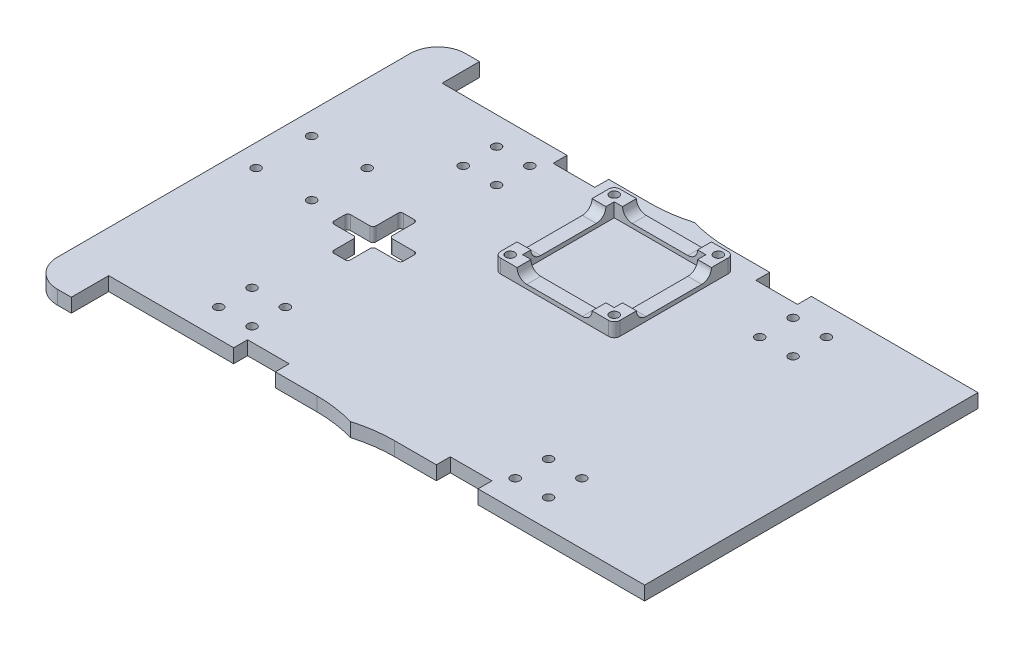
from build123d import *

# Parameters (mm, degrees)
SKETCH1_W            = 208
SKETCH1_H            = 147
BOSS_EXTRUDE1_DEPTH  = 5
CUT_EXTRUDE2_DEPTH   = 128.449009412
MIRROR2_COPY_1_DEPTH = 128.449009412
FILLET1_R            = 10
CUT_EXTRUDE3_DEPTH   = 128.449009412
SKETCH5_R            = 1.6
CUT_EXTRUDE4_DEPTH   = 10
SKETCH8_R            = 1.6
CUT_EXTRUDE5_DEPTH   = 10
SKETCH9_W            = 43
SKETCH9_H            = 43
SKETCH9_W_2          = 33
SKETCH9_H_2          = 33
BOSS_EXTRUDE3_DEPTH  = 5
SKETCH10_W           = 27
SKETCH10_H           = 3.5
CUT_EXTRUDE6_DEPTH   = 62
SKETCH11_W           = 27
SKETCH11_H           = 3.5
CUT_EXTRUDE7_DEPTH   = 62
FILLET4_R            = 3.5
SKETCH12_R           = 1.6
CUT_EXTRUDE8_DEPTH   = 62
FILLET5_R            = 3.5
FILLET6_R            = 2
SKETCH14_W           = 15
SKETCH14_H           = 13.472377551
CUT_EXTRUDE10_DEPTH  = 10


with BuildPart() as part:
    # Sketch1 → Boss-Extrude1 (new body)
    with BuildSketch(Plane(origin=(0, 0, 0), x_dir=(1, 0, 0), z_dir=(0, 1, 0))):
        Rectangle(SKETCH1_W, SKETCH1_H)
    extrude(amount=BOSS_EXTRUDE1_DEPTH)

    # Sketch2 → Cut-Extrude2 (cut, through all)
    with BuildSketch(Plane(origin=(0, 5, 0), x_dir=(1, 0, 0), z_dir=(0, 1, 0))):
        with BuildLine():
            Line((-89, 80.027622449), (-89, 60.027622449))
            Line((-89, 60.027622449), (-44, 60.027622449))
            Line((-44, 60.027622449), (-44, 55.027622449))
            Line((-44, 55.027622449), (-29, 55.027622449))
            Line((-29, 55.027622449), (-29, 60.027622449))
            Line((-29, 60.027622449), (-14, 60.027622449))
            ThreePointArc((-14, 60.027622449), (-6.928932188, 60.530147766), (0, 62.027622449))
            Line((0, 62.027622449), (0, 82.027622449))
            Line((0, 82.027622449), (-89, 82.027622449))
            Line((-89, 82.027622449), (-89, 80.027622449))
        make_face()
    cut_extrude2 = extrude(amount=-CUT_EXTRUDE2_DEPTH, mode=Mode.SUBTRACT)

    # Mirror1: Cut-Extrude2 across plane
    add(cut_extrude2.mirror(Plane.XY), mode=Mode.SUBTRACT)

    # Mirror2: Cut-Extrude2 across plane
    add(cut_extrude2.mirror(Plane(origin=(0, 0, 0), x_dir=(0, 0, 1), z_dir=(1, 0, 0))), mode=Mode.SUBTRACT)

    # Mirror2 copy 1 sketch → Mirror2 copy 1 (cut, through all)
    with BuildSketch(Plane(origin=(0, 5, 0), x_dir=(-1, 0, 0), z_dir=(0, 1, 0))):
        with BuildLine():
            Line((-89, 80.027622449), (-89, 60.027622449))
            Line((-89, 60.027622449), (-44, 60.027622449))
            Line((-44, 60.027622449), (-44, 55.027622449))
            Line((-44, 55.027622449), (-29, 55.027622449))
            Line((-29, 55.027622449), (-29, 60.027622449))
            Line((-29, 60.027622449), (-14, 60.027622449))
            ThreePointArc((-14, 60.027622449), (-6.928932188, 60.530147766), (0, 62.027622449))
            Line((0, 62.027622449), (0, 82.027622449))
            Line((0, 82.027622449), (-89, 82.027622449))
            Line((-89, 82.027622449), (-89, 80.027622449))
        make_face()
    extrude(amount=-MIRROR2_COPY_1_DEPTH, mode=Mode.SUBTRACT)

    # Fillet1
    fillet1_edges = [part.edges().sort_by_distance(p)[0] for p in [
        (-104, 2.5, -73.5),
        (104, 2.5, -73.5),
        (104, 2.5, 73.5),
        (-104, 2.5, 73.5),
    ]]
    fillet(fillet1_edges, radius=FILLET1_R)

    # Sketch3 → Cut-Extrude3 (cut, through all)
    with BuildSketch(Plane(origin=(0, 5, 0), x_dir=(1, 0, 0), z_dir=(0, 1, 0))):
        with BuildLine():
            Line((-56.39463696, -4.457125787), (-56.39463696, -11.538322368))
            ThreePointArc((-56.39463696, -11.538322368), (-56.101743741, -12.245429149), (-55.39463696, -12.538322368))
            Line((-55.39463696, -12.538322368), (-51.39463696, -12.538322368))
            ThreePointArc((-51.39463696, -12.538322368), (-50.687530178, -12.245429149), (-50.39463696, -11.538322368))
            Line((-50.39463696, -11.538322368), (-50.39463696, -4.457125787))
            ThreePointArc((-50.39463696, -4.457125787), (-50.101743741, -3.750019006), (-49.39463696, -3.457125787))
            Line((-49.39463696, -3.457125787), (-41.475833541, -3.457125787))
            ThreePointArc((-41.475833541, -3.457125787), (-40.76872676, -3.164232568), (-40.475833541, -2.457125787))
            Line((-40.475833541, -2.457125787), (-40.475833541, 1.542874213))
            ThreePointArc((-40.475833541, 1.542874213), (-40.76872676, 2.249980994), (-41.475833541, 2.542874213))
            Line((-41.475833541, 2.542874213), (-49.39463696, 2.542874213))
            ThreePointArc((-49.39463696, 2.542874213), (-50.101743741, 2.835767432), (-50.39463696, 3.542874213))
            Line((-50.39463696, 3.542874213), (-50.39463696, 11.461677632))
            ThreePointArc((-50.39463696, 11.461677632), (-50.687530178, 12.168784413), (-51.39463696, 12.461677632))
            Line((-51.39463696, 12.461677632), (-55.39463696, 12.461677632))
            ThreePointArc((-55.39463696, 12.461677632), (-56.101743741, 12.168784413), (-56.39463696, 11.461677632))
            Line((-56.39463696, 11.461677632), (-56.39463696, 3.542874213))
            ThreePointArc((-56.39463696, 3.542874213), (-56.687530178, 2.835767432), (-57.39463696, 2.542874213))
            Line((-57.39463696, 2.542874213), (-64.475833541, 2.542874213))
            ThreePointArc((-64.475833541, 2.542874213), (-65.182940322, 2.249980994), (-65.475833541, 1.542874213))
            Line((-65.475833541, 1.542874213), (-65.475833541, -2.457125787))
            ThreePointArc((-65.475833541, -2.457125787), (-65.182940322, -3.164232568), (-64.475833541, -3.457125787))
            Line((-64.475833541, -3.457125787), (-57.39463696, -3.457125787))
            ThreePointArc((-57.39463696, -3.457125787), (-56.687530178, -3.750019006), (-56.39463696, -4.457125787))
        make_face()
    extrude(amount=-CUT_EXTRUDE3_DEPTH, mode=Mode.SUBTRACT)

    # Sketch5 → Cut-Extrude4 (cut)
    with BuildSketch(Plane(origin=(0, 5, 0), x_dir=(1, 0, 0), z_dir=(0, 1, 0))):
        with Locations(Location((-96, 20.039754171, 0), (0, 0, 270))):
            Circle(SKETCH5_R)
        with Locations(Location((-76, 20.039754171, 0), (0, 0, 270))):
            Circle(SKETCH5_R)
        with Locations(Location((-76, 0.039754171, 0), (0, 0, 270))):
            Circle(SKETCH5_R)
        with Locations(Location((-96, 0.039754171, 0), (0, 0, 270))):
            Circle(SKETCH5_R)
    extrude(amount=-CUT_EXTRUDE4_DEPTH, mode=Mode.SUBTRACT)

    # Sketch8 → Cut-Extrude5 (cut)
    with BuildSketch(Plane(origin=(0, 5, 0), x_dir=(1, 0, 0), z_dir=(0, 1, 0))):
        with Locations(Location((-59.39463696, -50.027622449, 0), (0, 0, 270))):
            Circle(SKETCH8_R)
        with Locations(Location((-47.39463696, -50.027622449, 0), (0, 0, 270))):
            Circle(SKETCH8_R)
        with Locations(Location((-47.39463696, -38.027622449, 0), (0, 0, 270))):
            Circle(SKETCH8_R)
        with Locations(Location((-59.39463696, -38.027622449, 0), (0, 0, 270))):
            Circle(SKETCH8_R)
        with Locations(Location((-59.39463696, 50.027622449, 0), (0, 0, 90))):
            Circle(SKETCH8_R)
        with Locations(Location((-47.39463696, 50.027622449, 0), (0, 0, 90))):
            Circle(SKETCH8_R)
        with Locations(Location((-47.39463696, 38.027622449, 0), (0, 0, 90))):
            Circle(SKETCH8_R)
        with Locations(Location((-59.39463696, 38.027622449, 0), (0, 0, 90))):
            Circle(SKETCH8_R)
        with Locations(Location((59.39463696, 50.027622449, 0), (0, 0, 270))):
            Circle(SKETCH8_R)
        with Locations(Location((47.39463696, 50.027622449, 0), (0, 0, 270))):
            Circle(SKETCH8_R)
        with Locations(Location((47.39463696, 38.027622449, 0), (0, 0, 270))):
            Circle(SKETCH8_R)
        with Locations(Location((59.39463696, 38.027622449, 0), (0, 0, 270))):
            Circle(SKETCH8_R)
        with Locations(Location((47.39463696, -50.027622449, 0), (0, 0, 90))):
            Circle(SKETCH8_R)
        with Locations(Location((47.39463696, -38.027622449, 0), (0, 0, 90))):
            Circle(SKETCH8_R)
        with Locations(Location((59.39463696, -50.027622449, 0), (0, 0, 90))):
            Circle(SKETCH8_R)
        with Locations(Location((59.39463696, -38.027622449, 0), (0, 0, 90))):
            Circle(SKETCH8_R)
    extrude(amount=-CUT_EXTRUDE5_DEPTH, mode=Mode.SUBTRACT)

    # Sketch9 → Boss-Extrude3 (add)
    with BuildSketch(Plane(origin=(0, 5, 0), x_dir=(1, 0, 0), z_dir=(0, 1, 0))):
        with Locations((0.5, 32.527622449)):
            Rectangle(SKETCH9_W, SKETCH9_H)
        with Locations((0.5, 32.527622449)):
            Rectangle(SKETCH9_W_2, SKETCH9_H_2, mode=Mode.SUBTRACT)
    extrude(amount=BOSS_EXTRUDE3_DEPTH)

    # Sketch10 → Cut-Extrude6 (cut)
    with BuildSketch(Plane.XY.offset(-11.027622449)):
        with Locations((0.5, 8.25)):
            Rectangle(SKETCH10_W, SKETCH10_H)
    extrude(amount=-CUT_EXTRUDE6_DEPTH, mode=Mode.SUBTRACT)

    # Sketch11 → Cut-Extrude7 (cut)
    with BuildSketch(Plane(origin=(22, 0, 0), x_dir=(0, 0, -1), z_dir=(1, 0, 0))):
        with Locations((32.527622449, 8.25)):
            Rectangle(SKETCH11_W, SKETCH11_H)
    extrude(amount=-CUT_EXTRUDE7_DEPTH, mode=Mode.SUBTRACT)

    # Fillet4
    fillet4_edges = [part.edges().sort_by_distance(p)[0] for p in [
        (19.5, 6.5, -19.027622449),
        (19.5, 6.5, -46.027622449),
        (14, 6.5, -51.527622449),
        (-18.5, 6.5, -19.027622449),
        (-18.5, 6.5, -46.027622449),
        (-13, 6.5, -13.527622449),
    ]]
    fillet(fillet4_edges, radius=FILLET4_R - 0.0001)  # a hair under: the kernel refuses the full size

    # Sketch12 → Cut-Extrude8 (cut)
    with BuildSketch(Plane(origin=(0, 10, 0), x_dir=(1, 0, 0), z_dir=(0, 1, 0))):
        with Locations(Location((-18.25, 51.277622449, 0), (0, 0, 270))):
            Circle(SKETCH12_R)
        with Locations(Location((19.25, 51.277622449, 0), (0, 0, 90))):
            Circle(SKETCH12_R)
        with Locations(Location((19.25, 13.777622449, 0), (0, 0, 270))):
            Circle(SKETCH12_R)
        with Locations(Location((-18.25, 13.777622449, 0), (0, 0, 90))):
            Circle(SKETCH12_R)
    extrude(amount=-CUT_EXTRUDE8_DEPTH, mode=Mode.SUBTRACT)

    # Fillet5
    fillet5_edges = [part.edges().sort_by_distance(p)[0] for p in [
        (14, 6.5, -13.527622449),
        (-13, 6.5, -51.527622449),
    ]]
    fillet(fillet5_edges, radius=FILLET5_R - 0.0001)  # a hair under: the kernel refuses the full size

    # Fillet6
    fillet6_edges = [part.edges().sort_by_distance(p)[0] for p in [
        (-21, 7.5, -54.027622449),
        (-21, 7.5, -11.027622449),
        (22, 7.5, -11.027622449),
        (22, 7.5, -54.027622449),
    ]]
    fillet(fillet6_edges, radius=FILLET6_R)

    # Sketch14 → Cut-Extrude10 (cut)
    with BuildSketch(Plane(origin=(0, 5, 0), x_dir=(1, 0, 0), z_dir=(0, 1, 0))):
        with Locations((96.5, 66.763811225)):
            Rectangle(SKETCH14_W, SKETCH14_H)
        with Locations((96.5, -66.763811225)):
            Rectangle(SKETCH14_W, SKETCH14_H)
    extrude(amount=-CUT_EXTRUDE10_DEPTH, mode=Mode.SUBTRACT)


solid = part.part
